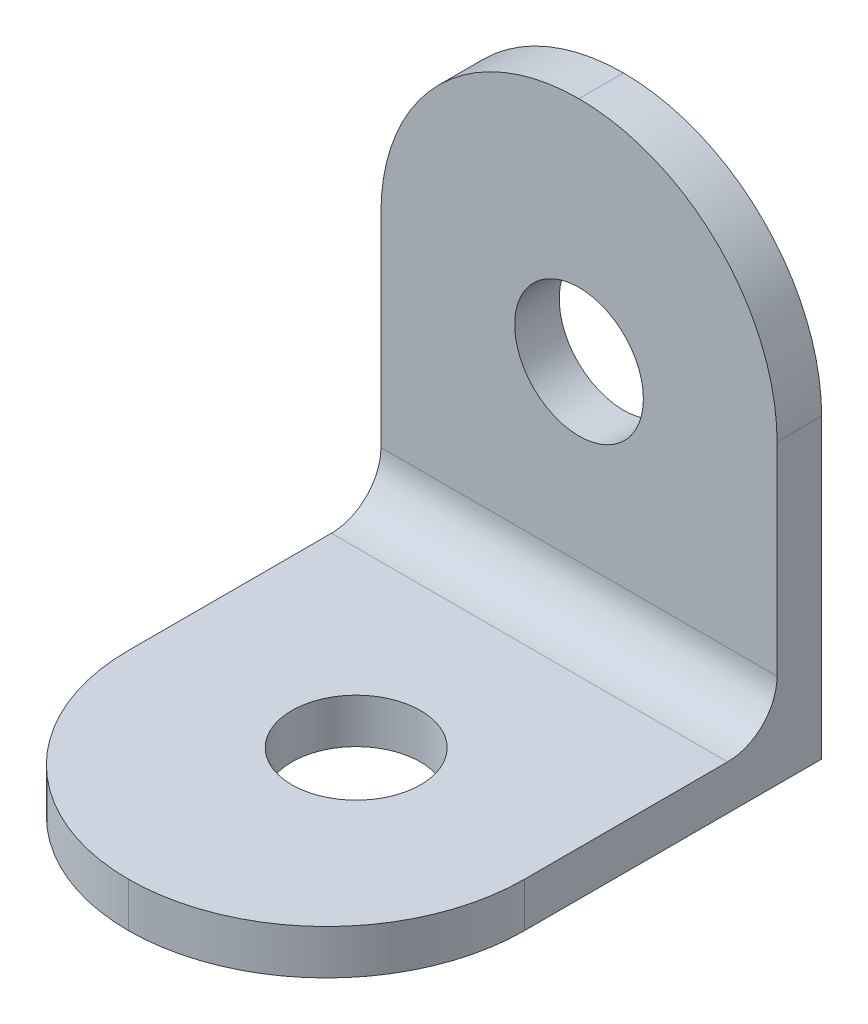
from build123d import *

# Parameters (mm, degrees)
SKETCH1_W           = 16
SKETCH1_H           = 20
BOSS_EXTRUDE1_DEPTH = 1.8
SKETCH2_W           = 16
SKETCH2_H           = 18.2
BOSS_EXTRUDE2_DEPTH = 1.8
SKETCH3_R           = 2.6
CUT_EXTRUDE1_DEPTH  = 1.8
SKETCH4_R           = 2.6
CUT_EXTRUDE2_DEPTH  = 1.8
FILLET1_R           = 2
FILLET2_R           = 8


with BuildPart() as part:
    # Sketch1 → Boss-Extrude1 (new body)
    with BuildSketch(Plane.XY):
        with Locations((8, 10)):
            Rectangle(SKETCH1_W, SKETCH1_H)
    extrude(amount=BOSS_EXTRUDE1_DEPTH)

    # Sketch2 → Boss-Extrude2 (add)
    with BuildSketch(Plane.XZ):
        with Locations((8, 10.9)):
            Rectangle(SKETCH2_W, SKETCH2_H)
    extrude(amount=-BOSS_EXTRUDE2_DEPTH)

    # Sketch3 → Cut-Extrude1 (cut)
    with BuildSketch(Plane.XY.offset(1.8)):
        with Locations((8, 10.8)):
            Circle(SKETCH3_R)
    extrude(amount=-CUT_EXTRUDE1_DEPTH, mode=Mode.SUBTRACT)

    # Sketch4 → Cut-Extrude2 (cut)
    with BuildSketch(Plane(origin=(0, 1.8, 0), x_dir=(1, 0, 0), z_dir=(0, 1, 0))):
        with Locations(Location((8, -10.8, 0), (0, 0, 270))):
            Circle(SKETCH4_R)
    extrude(amount=-CUT_EXTRUDE2_DEPTH, mode=Mode.SUBTRACT)

    # Fillet1
    fillet1_edges = [part.edges().sort_by_distance(p)[0] for p in [
        (8, 1.8, 1.8),
    ]]
    fillet(fillet1_edges, radius=FILLET1_R)

    # Fillet2
    fillet2_edges = [part.edges().sort_by_distance(p)[0] for p in [
        (16, 0.9, 20),
        (0, 0.9, 20),
        (16, 20, 0.9),
        (0, 20, 0.9),
    ]]
    fillet(fillet2_edges, radius=FILLET2_R - 0.0001)  # a hair under: the kernel refuses the full size


solid = part.part
